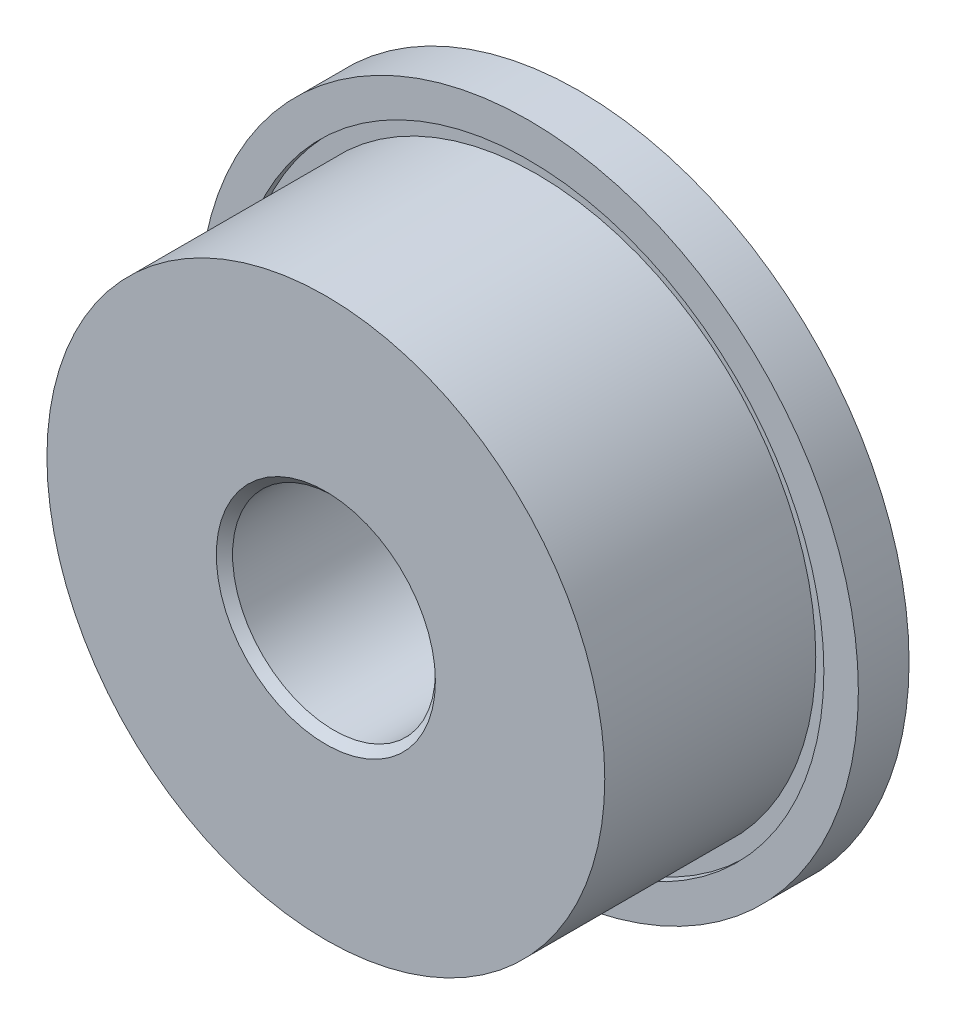
from build123d import *

# Parameters (mm, degrees)
SKETCH1_R           = 10.31875
BOSS_EXTRUDE1_DEPTH = 1.5875
SKETCH2_R           = 8.73125
BOSS_EXTRUDE2_DEPTH = 6.35
SKETCH3_R           = 6.35
BOSS_EXTRUDE3_DEPTH = 1.5875
SKETCH4_R           = 4.7625
SKETCH4_R_2         = 3.96875
CUT_EXTRUDE1_DEPTH  = 0.254
CUT_EXTRUDE2_START  = -0.254
SKETCH5_R           = 9.23925
SKETCH5_R_2         = 8.73125
CUT_EXTRUDE2_DEPTH  = 0.254
SKETCH6_R           = 3.175
CUT_EXTRUDE3_DEPTH  = 18.426383105
CHAMFER1_SIZE       = 0.254


with BuildPart() as part:
    # Sketch1 → Boss-Extrude1 (new body)
    with BuildSketch(Plane.XY):
        Circle(SKETCH1_R)
    extrude(amount=BOSS_EXTRUDE1_DEPTH)

    # Sketch2 → Boss-Extrude2 (add)
    with BuildSketch(Plane.XY.offset(1.5875)):
        Circle(SKETCH2_R)
    extrude(amount=BOSS_EXTRUDE2_DEPTH)

    # Sketch3 → Boss-Extrude3 (add)
    with BuildSketch(Plane(origin=(0, 0, 0), x_dir=(-1, 0, 0), z_dir=(0, 0, -1))):
        with Locations(Location((0, 0, 0), (0, 0, 180))):
            Circle(SKETCH3_R)
    extrude(amount=BOSS_EXTRUDE3_DEPTH)

    # Sketch4 → Cut-Extrude1 (cut)
    with BuildSketch(Plane(origin=(0, 0, -1.5875), x_dir=(-1, 0, 0), z_dir=(0, 0, -1))):
        Circle(SKETCH4_R)
        Circle(SKETCH4_R_2, mode=Mode.SUBTRACT)
    extrude(amount=-CUT_EXTRUDE1_DEPTH, mode=Mode.SUBTRACT)

    # Sketch5 → Cut-Extrude2 (cut)
    with BuildSketch(Plane.XY.offset(1.5875).offset(CUT_EXTRUDE2_START)):
        Circle(SKETCH5_R)
        Circle(SKETCH5_R_2, mode=Mode.SUBTRACT)
    extrude(amount=CUT_EXTRUDE2_DEPTH, mode=Mode.SUBTRACT)

    # Sketch6 → Cut-Extrude3 (cut, through all)
    with BuildSketch(Plane.XY.offset(7.9375)):
        Circle(SKETCH6_R)
    extrude(amount=-CUT_EXTRUDE3_DEPTH, mode=Mode.SUBTRACT)

    # Chamfer1
    chamfer1_edges = [part.edges().sort_by_distance(p)[0] for p in [
        (3.96875, 0, -1.5875),
        (-3.175, 0, -1.5875),
        (-3.175, 0, 7.9375),
    ]]
    chamfer(chamfer1_edges, length=CHAMFER1_SIZE - 0.0001)  # a hair under: the kernel refuses the full size


solid = part.part
